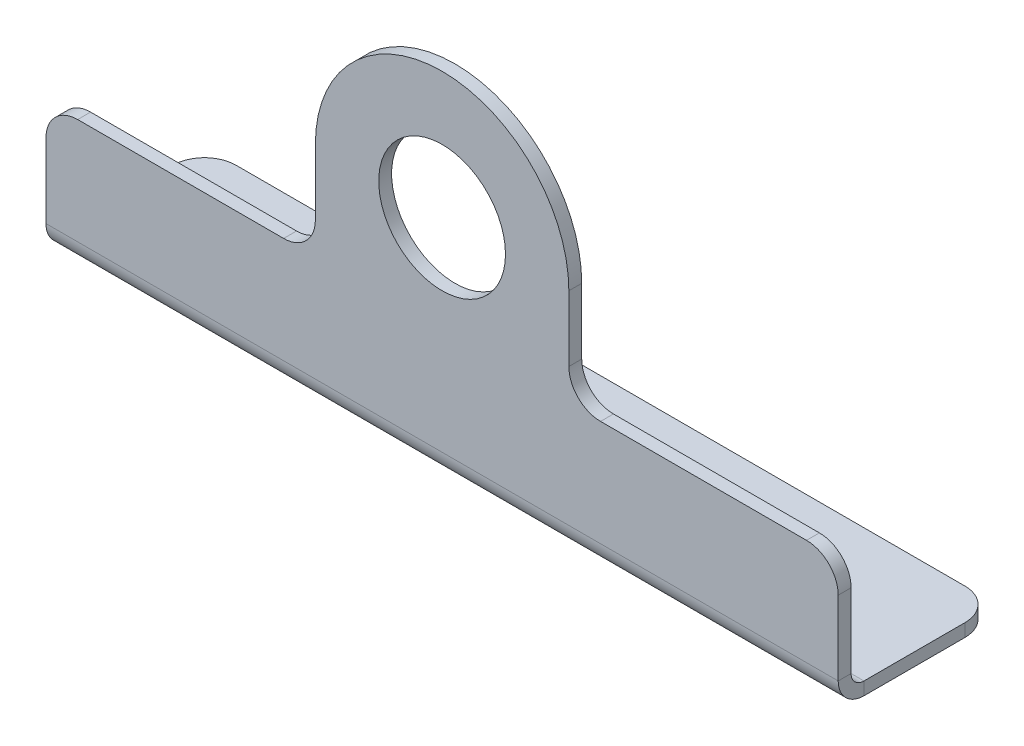
from build123d import *

# Parameters (mm, degrees)
SKETCH1_R                    = 4
BASE_FLANGE1_DEPTH           = 0.8128
EDGE_FLANGE1_STRIP_W         = 4.8768
EDGE_FLANGE1_STRIP_H         = 0.8128
EDGE_FLANGE1_STRIP_CUT_DEPTH = 50
EDGE_FLANGE1_DEPTH           = 50
FILLET2_R                    = 2
F_5_0MM_DOWEL_HOLE1_D        = 5


# Sheet-metal steps are written as plain solids
with BuildPart() as part:
    # Sketch1 → Base-Flange1 (new body)
    with BuildSketch(Plane.XY):
        with BuildLine():
            Line((-25, 0), (25, 0))
            Line((25, 0), (25, 5.5))
            ThreePointArc((25, 5.5), (24.414213562, 6.914213562), (23, 7.5))
            Line((23, 7.5), (10, 7.5))
            ThreePointArc((10, 7.5), (8.585786438, 8.085786438), (8, 9.5))
            Line((8, 9.5), (8, 13.64))
            ThreePointArc((8, 13.64), (0, 21.64), (-8, 13.64))
            Line((-8, 13.64), (-8, 9.5))
            ThreePointArc((-8, 9.5), (-8.585786438, 8.085786438), (-10, 7.5))
            Line((-10, 7.5), (-23, 7.5))
            ThreePointArc((-23, 7.5), (-24.414213562, 6.914213562), (-25, 5.5))
            Line((-25, 5.5), (-25, 0))
        make_face()
        with Locations((0, 13.64)):
            Circle(SKETCH1_R, mode=Mode.SUBTRACT)
    extrude(amount=-BASE_FLANGE1_DEPTH)

    # Edge-Flange1 strip (across the edge) → Edge-Flange1 strip cut (cut)
    with BuildSketch(Plane(origin=(25, 0, -0.8128), x_dir=(0, 1, 0), z_dir=(-1, 0, 0))):
        with Locations((-1.6256, -0.4064)):
            Rectangle(EDGE_FLANGE1_STRIP_W, EDGE_FLANGE1_STRIP_H)
    extrude(amount=EDGE_FLANGE1_STRIP_CUT_DEPTH, mode=Mode.SUBTRACT)

    # Edge-Flange1 section (across the edge) → Edge-Flange1 (add)
    with BuildSketch(Plane(origin=(25, 0, -0.8128), x_dir=(0, 1, 0), z_dir=(-1, 0, 0))):
        with BuildLine():
            Line((-0.8128, 0.8128), (-0.8128, 9.1872))
            Line((-0.8128, 9.1872), (0, 9.1872))
            Line((0, 9.1872), (0, 0.8128))
            ThreePointArc((0, 0.8128), (0.238063608, 0.238063608), (0.8128, 0))
            Line((0.8128, 0), (0.8128, -0.8128))
            ThreePointArc((0.8128, -0.8128), (-0.336672783, -0.336672783), (-0.8128, 0.8128))
        make_face()
    extrude(amount=EDGE_FLANGE1_DEPTH)

    # Fillet2
    fillet2_edges = [part.edges().sort_by_distance(p)[0] for p in [
        (25, -0.4064, -10),
        (-25, -0.4064, -10),
    ]]
    fillet(fillet2_edges, radius=FILLET2_R)

    # Ø5.0mm Dowel Hole1 (through all)
    with Locations(Plane(origin=(0, 0, 0), x_dir=(1, 0, 0), z_dir=(0, 1, 0))):
        with Locations((-12.5, 5.8128), (12.5, 5.8128)):
            Hole(F_5_0MM_DOWEL_HOLE1_D / 2)


solid = part.part
